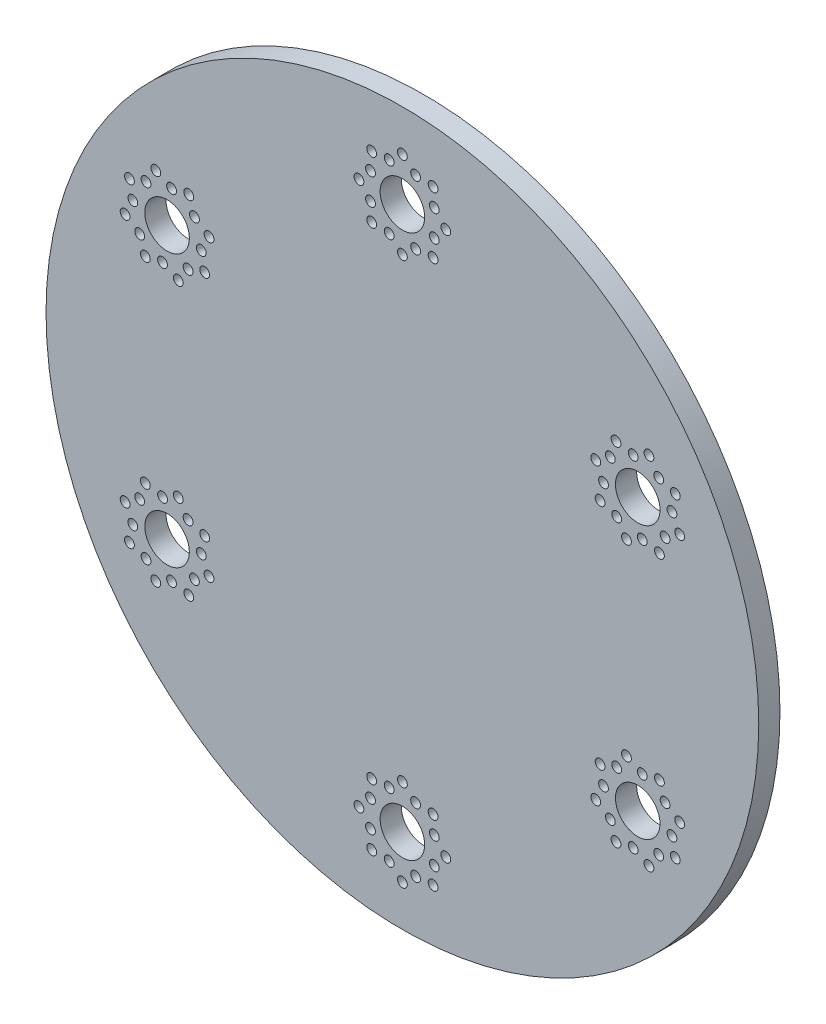
from build123d import *

# Parameters (mm, degrees)
SKETCH1_R           = 80
SKETCH1_R_2         = 1.1
SKETCH1_R_3         = 5
BOSS_EXTRUDE6_DEPTH = 1.5875
BOSS_EXTRUDE9_START = -3.175
SKETCH1_10_R        = 80
SKETCH1_10_R_2      = 1.1
SKETCH1_10_R_3      = 5
BOSS_EXTRUDE9_DEPTH = 3.175


with BuildPart() as part:
    # Sketch1 → Boss-Extrude6 (new body)
    with BuildSketch(Plane.XY):
        Circle(SKETCH1_R)
        with Locations((0, -70.75)):
            Circle(SKETCH1_R_2, mode=Mode.SUBTRACT)
        with Locations((-6.894291117, -67.894291117)):
            Circle(SKETCH1_R_2, mode=Mode.SUBTRACT)
        with Locations((-2.965796601, -68.160066377)):
            Circle(SKETCH1_R_2, mode=Mode.SUBTRACT)
        with Locations((-7.160066377, -63.965796601)):
            Circle(SKETCH1_R_2, mode=Mode.SUBTRACT)
        with Locations((-9.75, -61)):
            Circle(SKETCH1_R_2, mode=Mode.SUBTRACT)
        with Locations((0, -61)):
            Circle(SKETCH1_R_3, mode=Mode.SUBTRACT)
        with Locations((-7.160066377, -58.034203399)):
            Circle(SKETCH1_R_2, mode=Mode.SUBTRACT)
        with Locations((-6.894291117, -54.105708883)):
            Circle(SKETCH1_R_2, mode=Mode.SUBTRACT)
        with Locations((-2.965796601, -53.839933623)):
            Circle(SKETCH1_R_2, mode=Mode.SUBTRACT)
        with Locations((0, -51.25)):
            Circle(SKETCH1_R_2, mode=Mode.SUBTRACT)
        with Locations((-61.271297318, -35.375)):
            Circle(SKETCH1_R_2, mode=Mode.SUBTRACT)
        with Locations((-60.511247306, -31.51157799)):
            Circle(SKETCH1_R_2, mode=Mode.SUBTRACT)
        with Locations((-62.245326437, -27.97651431)):
            Circle(SKETCH1_R_2, mode=Mode.SUBTRACT)
        with Locations((-55.351035321, -39.917776806)):
            Circle(SKETCH1_R_2, mode=Mode.SUBTRACT)
        with Locations((-57.545450706, -36.648488387)):
            Circle(SKETCH1_R_2, mode=Mode.SUBTRACT)
        with Locations((-51.815971641, -38.183697676)):
            Circle(SKETCH1_R_2, mode=Mode.SUBTRACT)
        with Locations((-52.827549631, -30.5)):
            Circle(SKETCH1_R_3, mode=Mode.SUBTRACT)
        with Locations((-47.952549631, -38.943747687)):
            Circle(SKETCH1_R_2, mode=Mode.SUBTRACT)
        with Locations((-46.679061244, -35.217901075)):
            Circle(SKETCH1_R_2, mode=Mode.SUBTRACT)
        with Locations((-43.409772825, -33.02348569)):
            Circle(SKETCH1_R_2, mode=Mode.SUBTRACT)
        with Locations((-58.976038018, -25.782098925)):
            Circle(SKETCH1_R_2, mode=Mode.SUBTRACT)
        with Locations((-57.702549631, -22.056252313)):
            Circle(SKETCH1_R_2, mode=Mode.SUBTRACT)
        with Locations((-53.839127621, -22.816302324)):
            Circle(SKETCH1_R_2, mode=Mode.SUBTRACT)
        with Locations((-50.304063941, -21.082223194)):
            Circle(SKETCH1_R_2, mode=Mode.SUBTRACT)
        with Locations((-45.143851955, -29.48842201)):
            Circle(SKETCH1_R_2, mode=Mode.SUBTRACT)
        with Locations((-44.383801944, -25.625)):
            Circle(SKETCH1_R_2, mode=Mode.SUBTRACT)
        with Locations((-48.109648556, -24.351511613)):
            Circle(SKETCH1_R_2, mode=Mode.SUBTRACT)
        with Locations((2.965796601, -68.160066377)):
            Circle(SKETCH1_R_2, mode=Mode.SUBTRACT)
        with Locations((6.894291117, -67.894291117)):
            Circle(SKETCH1_R_2, mode=Mode.SUBTRACT)
        with Locations((7.160066377, -63.965796601)):
            Circle(SKETCH1_R_2, mode=Mode.SUBTRACT)
        with Locations((9.75, -61)):
            Circle(SKETCH1_R_2, mode=Mode.SUBTRACT)
        with Locations((7.160066377, -58.034203399)):
            Circle(SKETCH1_R_2, mode=Mode.SUBTRACT)
        with Locations((2.965796601, -53.839933623)):
            Circle(SKETCH1_R_2, mode=Mode.SUBTRACT)
        with Locations((6.894291117, -54.105708883)):
            Circle(SKETCH1_R_2, mode=Mode.SUBTRACT)
        with Locations((47.952549631, -38.943747687)):
            Circle(SKETCH1_R_2, mode=Mode.SUBTRACT)
        with Locations((46.679061244, -35.217901075)):
            Circle(SKETCH1_R_2, mode=Mode.SUBTRACT)
        with Locations((43.409772825, -33.02348569)):
            Circle(SKETCH1_R_2, mode=Mode.SUBTRACT)
        with Locations((51.815971641, -38.183697676)):
            Circle(SKETCH1_R_2, mode=Mode.SUBTRACT)
        with Locations((55.351035321, -39.917776806)):
            Circle(SKETCH1_R_2, mode=Mode.SUBTRACT)
        with Locations((57.545450706, -36.648488387)):
            Circle(SKETCH1_R_2, mode=Mode.SUBTRACT)
        with Locations((52.827549631, -30.5)):
            Circle(SKETCH1_R_3, mode=Mode.SUBTRACT)
        with Locations((44.383801944, -25.625)):
            Circle(SKETCH1_R_2, mode=Mode.SUBTRACT)
        with Locations((45.143851955, -29.48842201)):
            Circle(SKETCH1_R_2, mode=Mode.SUBTRACT)
        with Locations((48.109648556, -24.351511613)):
            Circle(SKETCH1_R_2, mode=Mode.SUBTRACT)
        with Locations((58.976038018, -25.782098925)):
            Circle(SKETCH1_R_2, mode=Mode.SUBTRACT)
        with Locations((53.839127621, -22.816302324)):
            Circle(SKETCH1_R_2, mode=Mode.SUBTRACT)
        with Locations((50.304063941, -21.082223194)):
            Circle(SKETCH1_R_2, mode=Mode.SUBTRACT)
        with Locations((57.702549631, -22.056252313)):
            Circle(SKETCH1_R_2, mode=Mode.SUBTRACT)
        with Locations((61.271297318, -35.375)):
            Circle(SKETCH1_R_2, mode=Mode.SUBTRACT)
        with Locations((60.511247306, -31.51157799)):
            Circle(SKETCH1_R_2, mode=Mode.SUBTRACT)
        with Locations((62.245326437, -27.97651431)):
            Circle(SKETCH1_R_2, mode=Mode.SUBTRACT)
        with Locations((-62.245326437, 27.97651431)):
            Circle(SKETCH1_R_2, mode=Mode.SUBTRACT)
        with Locations((-60.511247306, 31.51157799)):
            Circle(SKETCH1_R_2, mode=Mode.SUBTRACT)
        with Locations((-61.271297318, 35.375)):
            Circle(SKETCH1_R_2, mode=Mode.SUBTRACT)
        with Locations((-57.702549631, 22.056252313)):
            Circle(SKETCH1_R_2, mode=Mode.SUBTRACT)
        with Locations((-50.304063941, 21.082223194)):
            Circle(SKETCH1_R_2, mode=Mode.SUBTRACT)
        with Locations((-53.839127621, 22.816302324)):
            Circle(SKETCH1_R_2, mode=Mode.SUBTRACT)
        with Locations((-58.976038018, 25.782098925)):
            Circle(SKETCH1_R_2, mode=Mode.SUBTRACT)
        with Locations((-48.109648556, 24.351511613)):
            Circle(SKETCH1_R_2, mode=Mode.SUBTRACT)
        with Locations((-45.143851955, 29.48842201)):
            Circle(SKETCH1_R_2, mode=Mode.SUBTRACT)
        with Locations((-44.383801944, 25.625)):
            Circle(SKETCH1_R_2, mode=Mode.SUBTRACT)
        with Locations((-52.827549631, 30.5)):
            Circle(SKETCH1_R_3, mode=Mode.SUBTRACT)
        with Locations((-57.545450706, 36.648488387)):
            Circle(SKETCH1_R_2, mode=Mode.SUBTRACT)
        with Locations((-55.351035321, 39.917776806)):
            Circle(SKETCH1_R_2, mode=Mode.SUBTRACT)
        with Locations((-51.815971641, 38.183697676)):
            Circle(SKETCH1_R_2, mode=Mode.SUBTRACT)
        with Locations((-43.409772825, 33.02348569)):
            Circle(SKETCH1_R_2, mode=Mode.SUBTRACT)
        with Locations((-46.679061244, 35.217901075)):
            Circle(SKETCH1_R_2, mode=Mode.SUBTRACT)
        with Locations((-47.952549631, 38.943747687)):
            Circle(SKETCH1_R_2, mode=Mode.SUBTRACT)
        with Locations((-6.894291117, 54.105708883)):
            Circle(SKETCH1_R_2, mode=Mode.SUBTRACT)
        with Locations((-2.965796601, 53.839933623)):
            Circle(SKETCH1_R_2, mode=Mode.SUBTRACT)
        with Locations((-7.160066377, 58.034203399)):
            Circle(SKETCH1_R_2, mode=Mode.SUBTRACT)
        with Locations((-9.75, 61)):
            Circle(SKETCH1_R_2, mode=Mode.SUBTRACT)
        with Locations((-7.160066377, 63.965796601)):
            Circle(SKETCH1_R_2, mode=Mode.SUBTRACT)
        with Locations((-6.894291117, 67.894291117)):
            Circle(SKETCH1_R_2, mode=Mode.SUBTRACT)
        with Locations((-2.965796601, 68.160066377)):
            Circle(SKETCH1_R_2, mode=Mode.SUBTRACT)
        with Locations((48.109648556, 24.351511613)):
            Circle(SKETCH1_R_2, mode=Mode.SUBTRACT)
        with Locations((44.383801944, 25.625)):
            Circle(SKETCH1_R_2, mode=Mode.SUBTRACT)
        with Locations((45.143851955, 29.48842201)):
            Circle(SKETCH1_R_2, mode=Mode.SUBTRACT)
        with Locations((50.304063941, 21.082223194)):
            Circle(SKETCH1_R_2, mode=Mode.SUBTRACT)
        with Locations((53.839127621, 22.816302324)):
            Circle(SKETCH1_R_2, mode=Mode.SUBTRACT)
        with Locations((57.702549631, 22.056252313)):
            Circle(SKETCH1_R_2, mode=Mode.SUBTRACT)
        with Locations((58.976038018, 25.782098925)):
            Circle(SKETCH1_R_2, mode=Mode.SUBTRACT)
        with Locations((43.409772825, 33.02348569)):
            Circle(SKETCH1_R_2, mode=Mode.SUBTRACT)
        with Locations((46.679061244, 35.217901075)):
            Circle(SKETCH1_R_2, mode=Mode.SUBTRACT)
        with Locations((47.952549631, 38.943747687)):
            Circle(SKETCH1_R_2, mode=Mode.SUBTRACT)
        with Locations((52.827549631, 30.5)):
            Circle(SKETCH1_R_3, mode=Mode.SUBTRACT)
        with Locations((51.815971641, 38.183697676)):
            Circle(SKETCH1_R_2, mode=Mode.SUBTRACT)
        with Locations((57.545450706, 36.648488387)):
            Circle(SKETCH1_R_2, mode=Mode.SUBTRACT)
        with Locations((55.351035321, 39.917776806)):
            Circle(SKETCH1_R_2, mode=Mode.SUBTRACT)
        with Locations((62.245326437, 27.97651431)):
            Circle(SKETCH1_R_2, mode=Mode.SUBTRACT)
        with Locations((60.511247306, 31.51157799)):
            Circle(SKETCH1_R_2, mode=Mode.SUBTRACT)
        with Locations((61.271297318, 35.375)):
            Circle(SKETCH1_R_2, mode=Mode.SUBTRACT)
        with Locations((0, 51.25)):
            Circle(SKETCH1_R_2, mode=Mode.SUBTRACT)
        with Locations((2.965796601, 53.839933623)):
            Circle(SKETCH1_R_2, mode=Mode.SUBTRACT)
        with Locations((6.894291117, 54.105708883)):
            Circle(SKETCH1_R_2, mode=Mode.SUBTRACT)
        with Locations((7.160066377, 58.034203399)):
            Circle(SKETCH1_R_2, mode=Mode.SUBTRACT)
        with Locations((0, 61)):
            Circle(SKETCH1_R_3, mode=Mode.SUBTRACT)
        with Locations((9.75, 61)):
            Circle(SKETCH1_R_2, mode=Mode.SUBTRACT)
        with Locations((7.160066377, 63.965796601)):
            Circle(SKETCH1_R_2, mode=Mode.SUBTRACT)
        with Locations((2.965796601, 68.160066377)):
            Circle(SKETCH1_R_2, mode=Mode.SUBTRACT)
        with Locations((6.894291117, 67.894291117)):
            Circle(SKETCH1_R_2, mode=Mode.SUBTRACT)
        with Locations((0, 70.75)):
            Circle(SKETCH1_R_2, mode=Mode.SUBTRACT)
    extrude(amount=BOSS_EXTRUDE6_DEPTH)

    # Sketch1<10> → Boss-Extrude9 (add)
    with BuildSketch(Plane.XY.offset(BOSS_EXTRUDE9_START)):
        Circle(SKETCH1_10_R)
        with Locations((6.894291117, 67.894291117)):
            Circle(SKETCH1_10_R_2, mode=Mode.SUBTRACT)
        with Locations((0, 70.75)):
            Circle(SKETCH1_10_R_2, mode=Mode.SUBTRACT)
        with Locations((9.75, 61)):
            Circle(SKETCH1_10_R_2, mode=Mode.SUBTRACT)
        with Locations((6.894291117, 54.105708883)):
            Circle(SKETCH1_10_R_2, mode=Mode.SUBTRACT)
        with Locations((0, 51.25)):
            Circle(SKETCH1_10_R_2, mode=Mode.SUBTRACT)
        with Locations((-6.894291117, 54.105708883)):
            Circle(SKETCH1_10_R_2, mode=Mode.SUBTRACT)
        with Locations((-9.75, 61)):
            Circle(SKETCH1_10_R_2, mode=Mode.SUBTRACT)
        with Locations((-6.894291117, 67.894291117)):
            Circle(SKETCH1_10_R_2, mode=Mode.SUBTRACT)
        with Locations((0, 61)):
            Circle(SKETCH1_10_R_3, mode=Mode.SUBTRACT)
        with Locations((7.160066377, 63.965796601)):
            Circle(SKETCH1_10_R_2, mode=Mode.SUBTRACT)
        with Locations((2.965796601, 68.160066377)):
            Circle(SKETCH1_10_R_2, mode=Mode.SUBTRACT)
        with Locations((7.160066377, 58.034203399)):
            Circle(SKETCH1_10_R_2, mode=Mode.SUBTRACT)
        with Locations((2.965796601, 53.839933623)):
            Circle(SKETCH1_10_R_2, mode=Mode.SUBTRACT)
        with Locations((-2.965796601, 53.839933623)):
            Circle(SKETCH1_10_R_2, mode=Mode.SUBTRACT)
        with Locations((-7.160066377, 58.034203399)):
            Circle(SKETCH1_10_R_2, mode=Mode.SUBTRACT)
        with Locations((-7.160066377, 63.965796601)):
            Circle(SKETCH1_10_R_2, mode=Mode.SUBTRACT)
        with Locations((-2.965796601, 68.160066377)):
            Circle(SKETCH1_10_R_2, mode=Mode.SUBTRACT)
        with Locations((62.245326437, 27.97651431)):
            Circle(SKETCH1_10_R_2, mode=Mode.SUBTRACT)
        with Locations((61.271297318, 35.375)):
            Circle(SKETCH1_10_R_2, mode=Mode.SUBTRACT)
        with Locations((57.702549631, 22.056252313)):
            Circle(SKETCH1_10_R_2, mode=Mode.SUBTRACT)
        with Locations((50.304063941, 21.082223194)):
            Circle(SKETCH1_10_R_2, mode=Mode.SUBTRACT)
        with Locations((44.383801944, 25.625)):
            Circle(SKETCH1_10_R_2, mode=Mode.SUBTRACT)
        with Locations((43.409772825, 33.02348569)):
            Circle(SKETCH1_10_R_2, mode=Mode.SUBTRACT)
        with Locations((47.952549631, 38.943747687)):
            Circle(SKETCH1_10_R_2, mode=Mode.SUBTRACT)
        with Locations((55.351035321, 39.917776806)):
            Circle(SKETCH1_10_R_2, mode=Mode.SUBTRACT)
        with Locations((52.827549631, 30.5)):
            Circle(SKETCH1_10_R_3, mode=Mode.SUBTRACT)
        with Locations((58.976038018, 25.782098925)):
            Circle(SKETCH1_10_R_2, mode=Mode.SUBTRACT)
        with Locations((60.511247306, 31.51157799)):
            Circle(SKETCH1_10_R_2, mode=Mode.SUBTRACT)
        with Locations((53.839127621, 22.816302324)):
            Circle(SKETCH1_10_R_2, mode=Mode.SUBTRACT)
        with Locations((48.109648556, 24.351511613)):
            Circle(SKETCH1_10_R_2, mode=Mode.SUBTRACT)
        with Locations((45.143851955, 29.48842201)):
            Circle(SKETCH1_10_R_2, mode=Mode.SUBTRACT)
        with Locations((46.679061244, 35.217901075)):
            Circle(SKETCH1_10_R_2, mode=Mode.SUBTRACT)
        with Locations((51.815971641, 38.183697676)):
            Circle(SKETCH1_10_R_2, mode=Mode.SUBTRACT)
        with Locations((57.545450706, 36.648488387)):
            Circle(SKETCH1_10_R_2, mode=Mode.SUBTRACT)
        with Locations((55.351035321, -39.917776806)):
            Circle(SKETCH1_10_R_2, mode=Mode.SUBTRACT)
        with Locations((61.271297318, -35.375)):
            Circle(SKETCH1_10_R_2, mode=Mode.SUBTRACT)
        with Locations((47.952549631, -38.943747687)):
            Circle(SKETCH1_10_R_2, mode=Mode.SUBTRACT)
        with Locations((43.409772825, -33.02348569)):
            Circle(SKETCH1_10_R_2, mode=Mode.SUBTRACT)
        with Locations((44.383801944, -25.625)):
            Circle(SKETCH1_10_R_2, mode=Mode.SUBTRACT)
        with Locations((50.304063941, -21.082223194)):
            Circle(SKETCH1_10_R_2, mode=Mode.SUBTRACT)
        with Locations((57.702549631, -22.056252313)):
            Circle(SKETCH1_10_R_2, mode=Mode.SUBTRACT)
        with Locations((62.245326437, -27.97651431)):
            Circle(SKETCH1_10_R_2, mode=Mode.SUBTRACT)
        with Locations((52.827549631, -30.5)):
            Circle(SKETCH1_10_R_3, mode=Mode.SUBTRACT)
        with Locations((51.815971641, -38.183697676)):
            Circle(SKETCH1_10_R_2, mode=Mode.SUBTRACT)
        with Locations((57.545450706, -36.648488387)):
            Circle(SKETCH1_10_R_2, mode=Mode.SUBTRACT)
        with Locations((46.679061244, -35.217901075)):
            Circle(SKETCH1_10_R_2, mode=Mode.SUBTRACT)
        with Locations((45.143851955, -29.48842201)):
            Circle(SKETCH1_10_R_2, mode=Mode.SUBTRACT)
        with Locations((48.109648556, -24.351511613)):
            Circle(SKETCH1_10_R_2, mode=Mode.SUBTRACT)
        with Locations((53.839127621, -22.816302324)):
            Circle(SKETCH1_10_R_2, mode=Mode.SUBTRACT)
        with Locations((58.976038018, -25.782098925)):
            Circle(SKETCH1_10_R_2, mode=Mode.SUBTRACT)
        with Locations((60.511247306, -31.51157799)):
            Circle(SKETCH1_10_R_2, mode=Mode.SUBTRACT)
        with Locations((-6.894291117, -67.894291117)):
            Circle(SKETCH1_10_R_2, mode=Mode.SUBTRACT)
        with Locations((0, -70.75)):
            Circle(SKETCH1_10_R_2, mode=Mode.SUBTRACT)
        with Locations((-9.75, -61)):
            Circle(SKETCH1_10_R_2, mode=Mode.SUBTRACT)
        with Locations((-6.894291117, -54.105708883)):
            Circle(SKETCH1_10_R_2, mode=Mode.SUBTRACT)
        with Locations((0, -51.25)):
            Circle(SKETCH1_10_R_2, mode=Mode.SUBTRACT)
        with Locations((6.894291117, -54.105708883)):
            Circle(SKETCH1_10_R_2, mode=Mode.SUBTRACT)
        with Locations((9.75, -61)):
            Circle(SKETCH1_10_R_2, mode=Mode.SUBTRACT)
        with Locations((6.894291117, -67.894291117)):
            Circle(SKETCH1_10_R_2, mode=Mode.SUBTRACT)
        with Locations((0, -61)):
            Circle(SKETCH1_10_R_3, mode=Mode.SUBTRACT)
        with Locations((-7.160066377, -63.965796601)):
            Circle(SKETCH1_10_R_2, mode=Mode.SUBTRACT)
        with Locations((-2.965796601, -68.160066377)):
            Circle(SKETCH1_10_R_2, mode=Mode.SUBTRACT)
        with Locations((-7.160066377, -58.034203399)):
            Circle(SKETCH1_10_R_2, mode=Mode.SUBTRACT)
        with Locations((-2.965796601, -53.839933623)):
            Circle(SKETCH1_10_R_2, mode=Mode.SUBTRACT)
        with Locations((2.965796601, -53.839933623)):
            Circle(SKETCH1_10_R_2, mode=Mode.SUBTRACT)
        with Locations((7.160066377, -58.034203399)):
            Circle(SKETCH1_10_R_2, mode=Mode.SUBTRACT)
        with Locations((7.160066377, -63.965796601)):
            Circle(SKETCH1_10_R_2, mode=Mode.SUBTRACT)
        with Locations((2.965796601, -68.160066377)):
            Circle(SKETCH1_10_R_2, mode=Mode.SUBTRACT)
        with Locations((-62.245326437, -27.97651431)):
            Circle(SKETCH1_10_R_2, mode=Mode.SUBTRACT)
        with Locations((-61.271297318, -35.375)):
            Circle(SKETCH1_10_R_2, mode=Mode.SUBTRACT)
        with Locations((-57.702549631, -22.056252313)):
            Circle(SKETCH1_10_R_2, mode=Mode.SUBTRACT)
        with Locations((-50.304063941, -21.082223194)):
            Circle(SKETCH1_10_R_2, mode=Mode.SUBTRACT)
        with Locations((-44.383801944, -25.625)):
            Circle(SKETCH1_10_R_2, mode=Mode.SUBTRACT)
        with Locations((-43.409772825, -33.02348569)):
            Circle(SKETCH1_10_R_2, mode=Mode.SUBTRACT)
        with Locations((-47.952549631, -38.943747687)):
            Circle(SKETCH1_10_R_2, mode=Mode.SUBTRACT)
        with Locations((-55.351035321, -39.917776806)):
            Circle(SKETCH1_10_R_2, mode=Mode.SUBTRACT)
        with Locations((-52.827549631, -30.5)):
            Circle(SKETCH1_10_R_3, mode=Mode.SUBTRACT)
        with Locations((-58.976038018, -25.782098925)):
            Circle(SKETCH1_10_R_2, mode=Mode.SUBTRACT)
        with Locations((-60.511247306, -31.51157799)):
            Circle(SKETCH1_10_R_2, mode=Mode.SUBTRACT)
        with Locations((-53.839127621, -22.816302324)):
            Circle(SKETCH1_10_R_2, mode=Mode.SUBTRACT)
        with Locations((-48.109648556, -24.351511613)):
            Circle(SKETCH1_10_R_2, mode=Mode.SUBTRACT)
        with Locations((-45.143851955, -29.48842201)):
            Circle(SKETCH1_10_R_2, mode=Mode.SUBTRACT)
        with Locations((-46.679061244, -35.217901075)):
            Circle(SKETCH1_10_R_2, mode=Mode.SUBTRACT)
        with Locations((-51.815971641, -38.183697676)):
            Circle(SKETCH1_10_R_2, mode=Mode.SUBTRACT)
        with Locations((-57.545450706, -36.648488387)):
            Circle(SKETCH1_10_R_2, mode=Mode.SUBTRACT)
        with Locations((-55.351035321, 39.917776806)):
            Circle(SKETCH1_10_R_2, mode=Mode.SUBTRACT)
        with Locations((-61.271297318, 35.375)):
            Circle(SKETCH1_10_R_2, mode=Mode.SUBTRACT)
        with Locations((-47.952549631, 38.943747687)):
            Circle(SKETCH1_10_R_2, mode=Mode.SUBTRACT)
        with Locations((-43.409772825, 33.02348569)):
            Circle(SKETCH1_10_R_2, mode=Mode.SUBTRACT)
        with Locations((-44.383801944, 25.625)):
            Circle(SKETCH1_10_R_2, mode=Mode.SUBTRACT)
        with Locations((-50.304063941, 21.082223194)):
            Circle(SKETCH1_10_R_2, mode=Mode.SUBTRACT)
        with Locations((-57.702549631, 22.056252313)):
            Circle(SKETCH1_10_R_2, mode=Mode.SUBTRACT)
        with Locations((-62.245326437, 27.97651431)):
            Circle(SKETCH1_10_R_2, mode=Mode.SUBTRACT)
        with Locations((-52.827549631, 30.5)):
            Circle(SKETCH1_10_R_3, mode=Mode.SUBTRACT)
        with Locations((-51.815971641, 38.183697676)):
            Circle(SKETCH1_10_R_2, mode=Mode.SUBTRACT)
        with Locations((-57.545450706, 36.648488387)):
            Circle(SKETCH1_10_R_2, mode=Mode.SUBTRACT)
        with Locations((-46.679061244, 35.217901075)):
            Circle(SKETCH1_10_R_2, mode=Mode.SUBTRACT)
        with Locations((-45.143851955, 29.48842201)):
            Circle(SKETCH1_10_R_2, mode=Mode.SUBTRACT)
        with Locations((-48.109648556, 24.351511613)):
            Circle(SKETCH1_10_R_2, mode=Mode.SUBTRACT)
        with Locations((-53.839127621, 22.816302324)):
            Circle(SKETCH1_10_R_2, mode=Mode.SUBTRACT)
        with Locations((-58.976038018, 25.782098925)):
            Circle(SKETCH1_10_R_2, mode=Mode.SUBTRACT)
        with Locations((-60.511247306, 31.51157799)):
            Circle(SKETCH1_10_R_2, mode=Mode.SUBTRACT)
    extrude(amount=BOSS_EXTRUDE9_DEPTH)


solid = part.part
